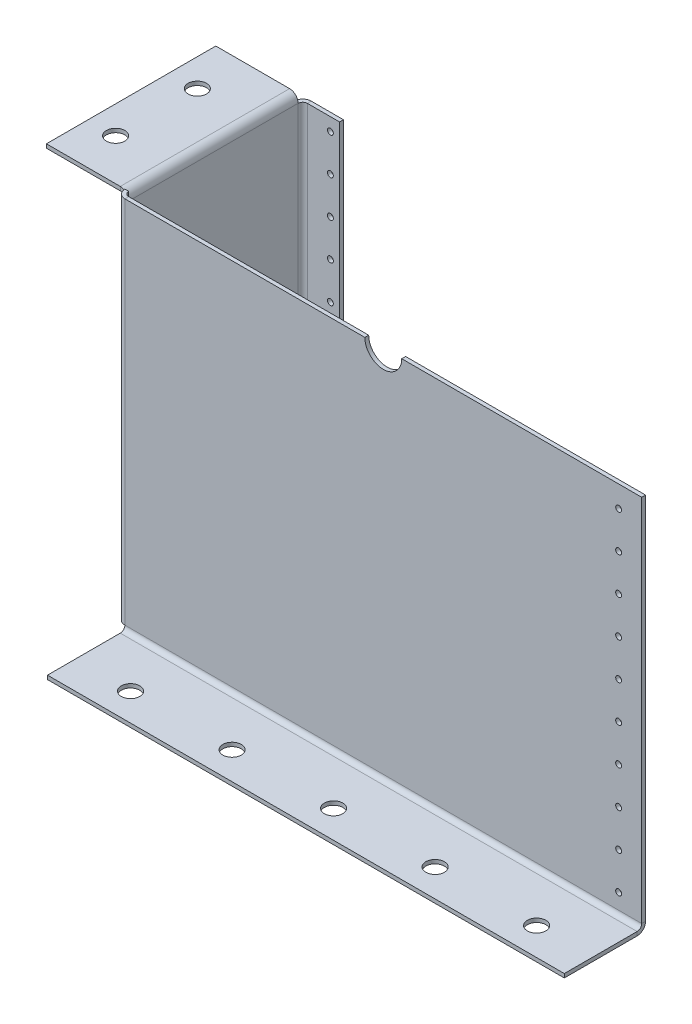
from build123d import *

# Parameters (mm, degrees)
BASE_FLANGE1_DEPTH           = 2.65684
SKETCHED_BEND3_DEPTH         = 355.6
SKETCHED_BEND3_2_DEPTH       = 355.6
SKETCH10_R                   = 6.35
CUT_EXTRUDE2_DEPTH           = 2.65684
EDGE_FLANGE5_DEPTH           = 254
EDGE_FLANGE6_STRIP_W         = 16.97736
EDGE_FLANGE6_STRIP_H         = 2.65684
EDGE_FLANGE6_STRIP_CUT_DEPTH = 116.5225
EDGE_FLANGE6_DEPTH           = 116.5225
EDGE_FLANGE7_DEPTH           = 248.16816
SKETCH34_R                   = 6.35
CUT_EXTRUDE3_DEPTH           = 2.65684
SKETCH38_R                   = 2.032
CUT_EXTRUDE4_DEPTH           = 2.65684
SKETCH39_R                   = 2.032
CUT_EXTRUDE5_DEPTH           = 2.65684
SKETCH40_R                   = 6.35
CUT_EXTRUDE6_DEPTH           = 2.65684


# Read off the part's stored shape, not the designer's step: Sketched Bend3
# Sheet-metal steps are written as plain solids
with BuildPart() as part:
    # Sketch1 → Base-Flange1 (new body)
    with BuildSketch(Plane.XY):
        with BuildLine():
            Line((0, 0), (0, 254))
            Line((0, 254), (165.1, 254))
            ThreePointArc((165.1, 254), (177.8, 241.3), (190.5, 254))
            Line((190.5, 254), (355.6, 254))
            Line((355.6, 254), (355.6, 0))
            Line((355.6, 0), (355.6, -57.15))
            Line((355.6, -57.15), (0, -57.15))
            Line((0, -57.15), (0, 0))
        make_face()
    extrude(amount=-BASE_FLANGE1_DEPTH)

    # Sketched Bend3 outline → Sketched Bend3 (cut)
    with BuildSketch(Plane.YZ):
        with BuildLine():
            ThreePointArc((0, -2.65684), (-2.783367186, -1.949765838), (-4.891802611, 0))
            Line((-4.891802611, 0), (-57.15, 0))
            Line((-57.15, 0), (-57.15, -2.65684))
            Line((-57.15, -2.65684), (0, -2.65684))
        make_face()
    extrude(amount=SKETCHED_BEND3_DEPTH, mode=Mode.SUBTRACT)

    # Sketched Bend3 2 outline → Sketched Bend3 2 (add)
    with BuildSketch(Plane.YZ):
        with BuildLine():
            ThreePointArc((0, 0), (-2.24506403, 0.92993597), (-3.175, 3.175))
            Line((-3.175, 3.175), (-3.175, 53.251044406))
            Line((-3.175, 53.251044406), (-5.83184, 53.251044406))
            Line((-5.83184, 53.251044406), (-5.83184, 3.175))
            ThreePointArc((-5.83184, 3.175), (-5.591894488, 1.519381136), (-4.891802611, 0))
            Line((-4.891802611, 0), (0, 0))
        make_face()
    extrude(amount=SKETCHED_BEND3_2_DEPTH)

    # Sketch10 → Cut-Extrude2 (cut)
    with BuildSketch(Plane(origin=(0, -3.175, 0), x_dir=(1, 0, 0), z_dir=(0, 1, 0))):
        with Locations(Location((317.5, -34.201044406, 0), (0, 0, 270))):
            Circle(SKETCH10_R)
        with Locations(Location((247.65, -34.201044406, 0), (0, 0, 270))):
            Circle(SKETCH10_R)
        with Locations(Location((38.1, -34.201044406, 0), (0, 0, 270))):
            Circle(SKETCH10_R)
        with Locations(Location((107.95, -34.201044406, 0), (0, 0, 270))):
            Circle(SKETCH10_R)
        with Locations(Location((177.8, -34.201044406, 0), (0, 0, 270))):
            Circle(SKETCH10_R)
    extrude(amount=-CUT_EXTRUDE2_DEPTH, mode=Mode.SUBTRACT)

    # Edge-Flange5 section (across the edge) → Edge-Flange5 (add)
    with BuildSketch(Plane(origin=(-3.175, 0, -2.65684), x_dir=(1, 0, 0), z_dir=(0, 1, 0))):
        with BuildLine():
            Line((-2.65684, 3.175), (-2.65684, 119.6975))
            Line((-2.65684, 119.6975), (0, 119.6975))
            Line((0, 119.6975), (0, 3.175))
            ThreePointArc((0, 3.175), (0.92993597, 0.92993597), (3.175, 0))
            Line((3.175, 0), (3.175, -2.65684))
            ThreePointArc((3.175, -2.65684), (-0.948733611, -0.948733611), (-2.65684, 3.175))
        make_face()
    extrude(amount=EDGE_FLANGE5_DEPTH)

    # Edge-Flange6 strip (across the edge) → Edge-Flange6 strip cut (cut)
    with BuildSketch(Plane(origin=(-5.83184, 254, -5.83184), x_dir=(0, -1, 0), z_dir=(0, 0, -1))):
        with Locations((-2.65684, -1.32842)):
            Rectangle(EDGE_FLANGE6_STRIP_W, EDGE_FLANGE6_STRIP_H)
    extrude(amount=EDGE_FLANGE6_STRIP_CUT_DEPTH, mode=Mode.SUBTRACT)

    # Edge-Flange6 section (across the edge) → Edge-Flange6 (add)
    with BuildSketch(Plane(origin=(-5.83184, 254, -5.83184), x_dir=(0, -1, 0), z_dir=(0, 0, -1))):
        with BuildLine():
            Line((0, 3.175), (0, 53.975))
            Line((0, 53.975), (2.65684, 53.975))
            Line((2.65684, 53.975), (2.65684, 3.175))
            ThreePointArc((2.65684, 3.175), (3.58677597, 0.92993597), (5.83184, 0))
            Line((5.83184, 0), (5.83184, -2.65684))
            ThreePointArc((5.83184, -2.65684), (1.708106389, -0.948733611), (0, 3.175))
        make_face()
    extrude(amount=EDGE_FLANGE6_DEPTH)

    # Edge-Flange7 section (across the edge) → Edge-Flange7 (add)
    with BuildSketch(Plane(origin=(-3.175, 0, -125.52934), x_dir=(0, 0, 1), z_dir=(0, 1, 0))):
        with BuildLine():
            Line((-2.65684, 3.175), (-2.65684, 25.4))
            Line((-2.65684, 25.4), (0, 25.4))
            Line((0, 25.4), (0, 3.175))
            ThreePointArc((0, 3.175), (0.92993597, 0.92993597), (3.175, 0))
            Line((3.175, 0), (3.175, -2.65684))
            ThreePointArc((3.175, -2.65684), (-0.948733611, -0.948733611), (-2.65684, 3.175))
        make_face()
    extrude(amount=EDGE_FLANGE7_DEPTH)

    # Sketch34 → Cut-Extrude3 (cut)
    with BuildSketch(Plane(origin=(0, 254, 0), x_dir=(1, 0, 0), z_dir=(0, 1, 0))):
        with Locations(Location((-40.75684, 90.60434, 0), (0, 0, 180))):
            Circle(SKETCH34_R)
        with Locations(Location((-40.75684, 34.40684, 0), (0, 0, 180))):
            Circle(SKETCH34_R)
    extrude(amount=-CUT_EXTRUDE3_DEPTH, mode=Mode.SUBTRACT)

    # Sketch38 → Cut-Extrude4 (cut)
    with BuildSketch(Plane(origin=(0, 0, -128.18618), x_dir=(-1, 0, 0), z_dir=(0, 0, -1))):
        with Locations((-15.875, 239.27816)):
            Circle(SKETCH38_R)
        with Locations((-15.875, 213.87816)):
            Circle(SKETCH38_R)
        with Locations((-15.875, 188.47816)):
            Circle(SKETCH38_R)
        with Locations((-15.875, 163.07816)):
            Circle(SKETCH38_R)
        with Locations((-15.875, 137.67816)):
            Circle(SKETCH38_R)
        with Locations((-15.875, 112.27816)):
            Circle(SKETCH38_R)
        with Locations((-15.875, 86.87816)):
            Circle(SKETCH38_R)
        with Locations((-15.875, 61.47816)):
            Circle(SKETCH38_R)
        with Locations((-15.875, 36.07816)):
            Circle(SKETCH38_R)
        with Locations((-15.875, 10.67816)):
            Circle(SKETCH38_R)
    extrude(amount=-CUT_EXTRUDE4_DEPTH, mode=Mode.SUBTRACT)

    # Sketch39 → Cut-Extrude5 (cut)
    with BuildSketch(Plane.XY):
        with Locations((339.725, 10.67816)):
            Circle(SKETCH39_R)
        with Locations((339.725, 36.07816)):
            Circle(SKETCH39_R)
        with Locations((339.725, 61.47816)):
            Circle(SKETCH39_R)
        with Locations((339.725, 86.87816)):
            Circle(SKETCH39_R)
        with Locations((339.725, 112.27816)):
            Circle(SKETCH39_R)
        with Locations((339.725, 137.67816)):
            Circle(SKETCH39_R)
        with Locations((339.725, 163.07816)):
            Circle(SKETCH39_R)
        with Locations((339.725, 188.47816)):
            Circle(SKETCH39_R)
        with Locations((339.725, 213.87816)):
            Circle(SKETCH39_R)
        with Locations((339.725, 239.27816)):
            Circle(SKETCH39_R)
    extrude(amount=-CUT_EXTRUDE5_DEPTH, mode=Mode.SUBTRACT)

    # Sketch40 → Cut-Extrude6 (cut)
    with BuildSketch(Plane.ZY.offset(5.83184)):
        with Locations((-34.40684, 41.79316)):
            Circle(SKETCH40_R)
        with Locations((-90.28684, 41.79316)):
            Circle(SKETCH40_R)
    extrude(amount=-CUT_EXTRUDE6_DEPTH, mode=Mode.SUBTRACT)


solid = part.part
